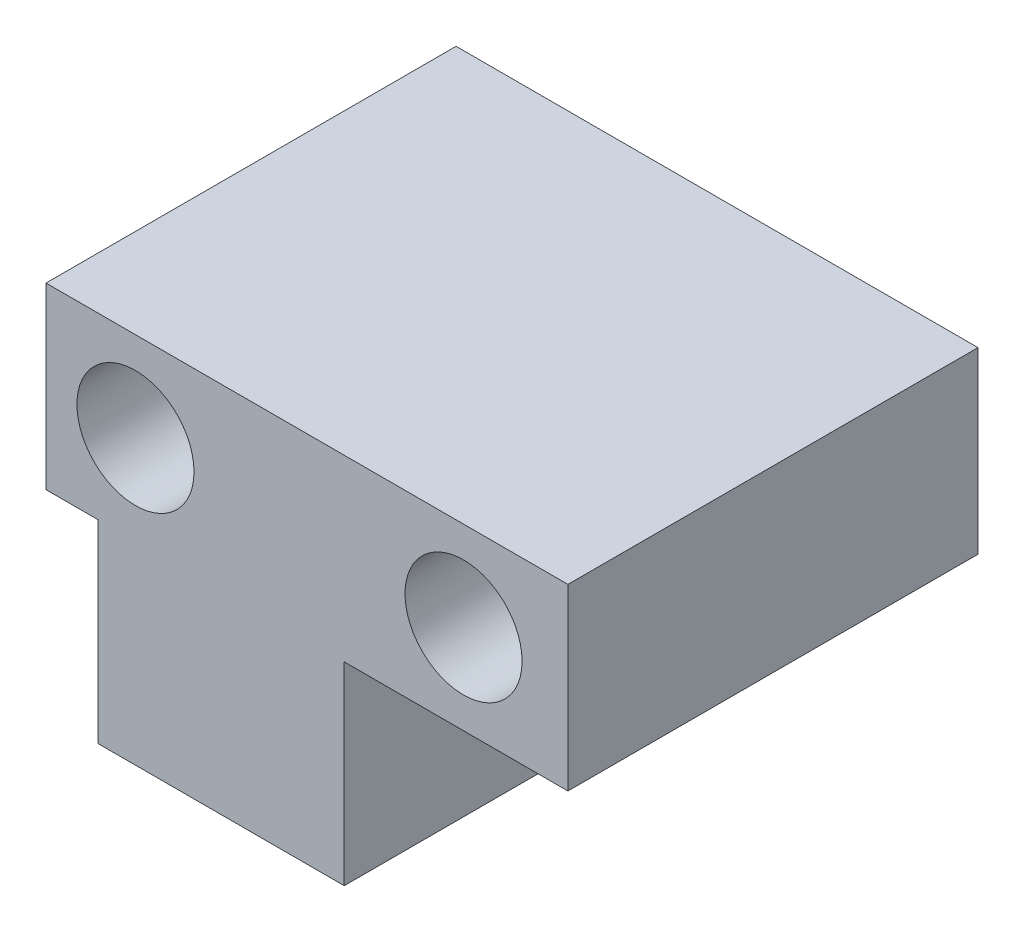
from build123d import *

# Parameters (mm, degrees)
ESQUISSE1_W             = 70
ESQUISSE1_H             = 24
BOSS_EXTRU_1_DEPTH      = 55
ESQUISSE2_R             = 7.85
ENL_V_MAT_EXTRU_1_DEPTH = 93.200867675
BOSS_EXTRU_3_DEPTH      = 21
ESQUISSE9_W             = 33
ESQUISSE9_H             = 55
BOSS_EXTRU_4_DEPTH      = 5
ESQUISSE10_R            = 1.5
ENL_V_MAT_EXTRU_4_DEPTH = 4


with BuildPart() as part:
    # Esquisse1 → Boss.-Extru.1 (new body)
    with BuildSketch(Plane.XY):
        with Locations((35, 12)):
            Rectangle(ESQUISSE1_W, ESQUISSE1_H)
    extrude(amount=BOSS_EXTRU_1_DEPTH)

    # Esquisse2 → Enlèv. mat.-Extru.1 (cut, through all)
    with BuildSketch(Plane.XY):
        with Locations((56, 12)):
            Circle(ESQUISSE2_R)
        with Locations((12, 12)):
            Circle(ESQUISSE2_R)
    extrude(amount=ENL_V_MAT_EXTRU_1_DEPTH, mode=Mode.SUBTRACT)

    # Esquisse6 → Boss.-Extru.3 (add)
    with BuildSketch(Plane.XZ):
        Polygon((7, 0), (40, 0), (40, 55), (7, 55), (7, 50), (35, 50), (35, 5), (7, 5), align=None)
    extrude(amount=BOSS_EXTRU_3_DEPTH)

    # Esquisse9 → Boss.-Extru.4 (add)
    with BuildSketch(Plane.XZ.offset(21)):
        with Locations((23.5, 27.5)):
            Rectangle(ESQUISSE9_W, ESQUISSE9_H)
    extrude(amount=BOSS_EXTRU_4_DEPTH)

    # Esquisse10 → Enlèv. mat.-Extru.4 (cut)
    with BuildSketch(Plane.ZY.offset(-7)):
        with Locations((52.5, -16)):
            Circle(ESQUISSE10_R)
        with Locations((52.5, -4)):
            Circle(ESQUISSE10_R)
        with Locations((2.5, -16)):
            Circle(ESQUISSE10_R)
        with Locations((2.5, -4)):
            Circle(ESQUISSE10_R)
    extrude(amount=-ENL_V_MAT_EXTRU_4_DEPTH, mode=Mode.SUBTRACT)


solid = part.part
